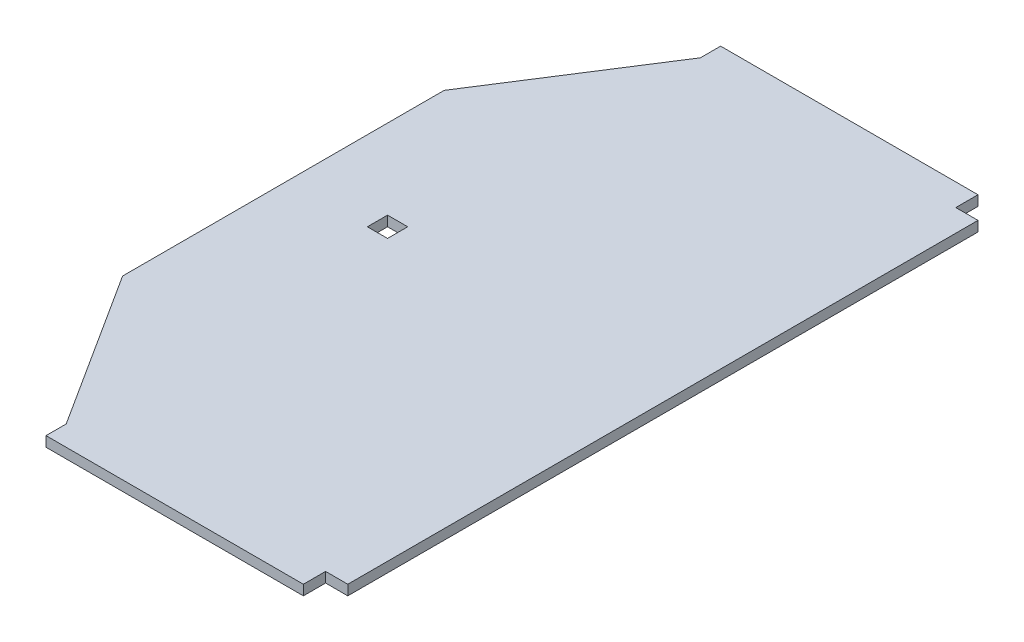
from build123d import *

# Parameters (mm, degrees)
BOSS_EXTRUDE2_DEPTH = 10
SKETCH4_W           = 20
SKETCH4_H           = 20
CUT_EXTRUDE1_DEPTH  = 10
SKETCH5_W           = 22
SKETCH5_H           = 22
CUT_EXTRUDE2_DEPTH  = 724.575030249


with BuildPart() as part:
    # Sketch1 → Boss-Extrude2 (new body)
    with BuildSketch(Plane(origin=(0, 0, 0), x_dir=(1, 0, 0), z_dir=(0, 1, 0))):
        Polygon((0, 0), (277, 0), (277, 668.38), (0, 668.38), (0, 648.38), (-99, 493.485), (-99, 334.19), (-99, 174.895), (0, 20), align=None)
    extrude(amount=BOSS_EXTRUDE2_DEPTH)

    # Sketch4 → Cut-Extrude1 (cut)
    with BuildSketch(Plane(origin=(0, 10, 0), x_dir=(1, 0, 0), z_dir=(0, 1, 0))):
        with Locations((-10, 348.38)):
            Rectangle(SKETCH4_W, SKETCH4_H)
    extrude(amount=-CUT_EXTRUDE1_DEPTH, mode=Mode.SUBTRACT)

    # Sketch5 → Cut-Extrude2 (cut, through all)
    with BuildSketch(Plane.XZ):
        with Locations((266, -657.38)):
            Rectangle(SKETCH5_W, SKETCH5_H)
        with Locations((266, -11)):
            Rectangle(SKETCH5_W, SKETCH5_H)
    extrude(amount=-CUT_EXTRUDE2_DEPTH, mode=Mode.SUBTRACT)


solid = part.part
